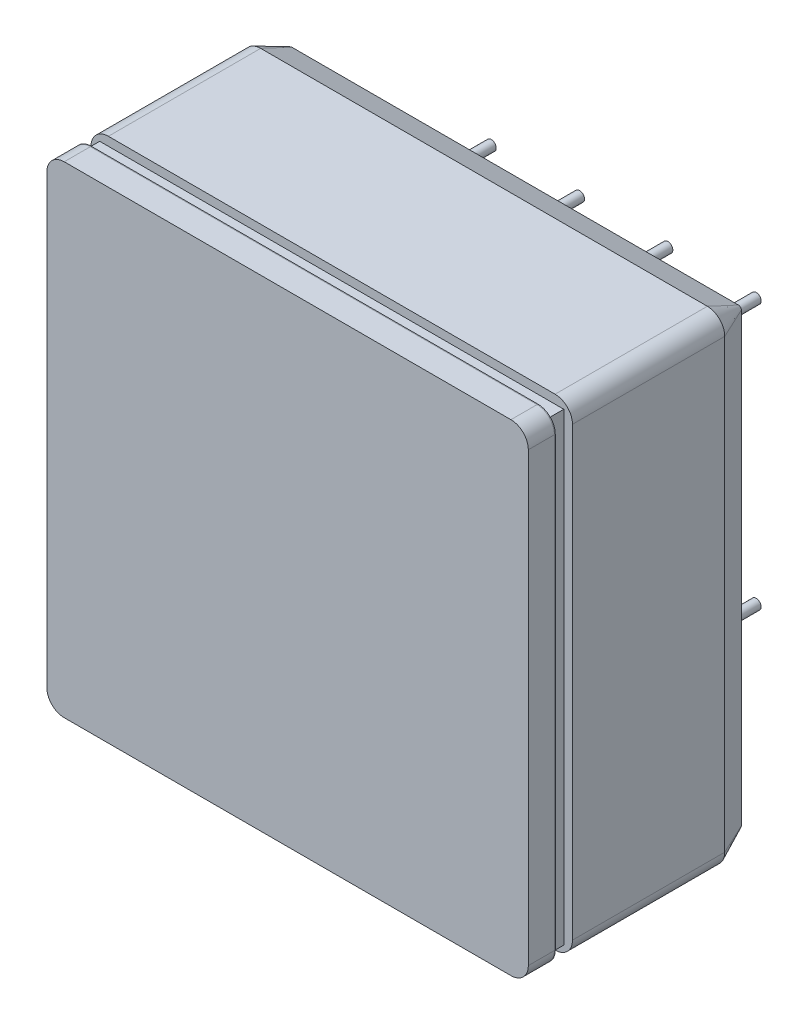
from build123d import *

# Parameters (mm, degrees)
METAL_CASE_AT_HV_DEPTH = 8.76
SKETCH3_W              = 24.737677246
SKETCH3_H              = 24.830501551
PHOTOCATHODE_DEPTH     = 0.1
SKETCH5_W              = 26.7
SKETCH5_H              = 26.7
SKETCH5_W_2            = 23.2
SKETCH5_H_2            = 23.2
BOSS_EXTRUDE3_DEPTH    = 0.99
MIRRORED_SURFACE_START = 0.05
SKETCH6_W              = 23.2
SKETCH6_H              = 23.2
MIRRORED_SURFACE_DEPTH = 0.05
FRONT_GLASS_DEPTH      = 1.5
SKETCH8_R              = 0.285
PINS_DEPTH             = 5.5
SKETCH9_W              = 1.403236588
SKETCH9_H              = 1.496318302
SKETCH9_W_2            = 1.502916358
SKETCH9_H_2            = 1.880163391
SKETCH9_W_3            = 1.432017479
SKETCH9_W_4            = 4.227959696
SKETCH9_W_5            = 1.836353851
SKETCH9_H_3            = 11.695124286
SKETCH9_H_4            = 4.871079897
SKETCH9_W_6            = 1.828629866
SKETCH9_H_5            = 1.71959621
SKETCH9_W_7            = 1.615933227
SKETCH9_W_8            = 1.365330314
SKETCH9_W_9            = 1.525378005
SKETCH9_H_6            = 1.496732956
SKETCH9_W_10           = 17.055037943
SKETCH9_H_7            = 1.444241572
SKETCH9_H_8            = 1.617700465
SKETCH9_H_9            = 1.513765196
SKETCH9_H_10           = 14.892572142
SKETCH9_H_11           = 1.645870576
SKETCH9_H_12           = 1.829290868
SKETCH9_W_11           = 1.140707165
SKETCH9_H_13           = 1.492116291
SKETCH9_W_12           = 1.724036428
SKETCH9_W_13           = 1.316199483
SKETCH9_H_14           = 1.570615298
SKETCH9_W_14           = 1.593474923
SKETCH9_W_15           = 1.889006141
SKETCH9_H_15           = 2.206356806
SKETCH9_W_16           = 6.877190486
SKETCH9_H_16           = 1.783898062
SKETCH9_W_17           = 1.759836844
SKETCH9_H_17           = 1.481039903
CUT_EXTRUDE1_DEPTH     = 5.5
RUBBER_DEPTH           = 1.79
RUBBER_TAPER           = 25


with BuildPart() as part:
    # Sketch2 → metal-case-at-HV (new body)
    with BuildSketch(Plane.XY.offset(-2.54)):
        with BuildLine():
            Line((1, 27.7), (26.7, 27.7))
            ThreePointArc((26.7, 27.7), (27.407106781, 27.407106781), (27.7, 26.7))
            Line((27.7, 26.7), (27.7, 1))
            ThreePointArc((27.7, 1), (27.407106781, 0.292893219), (26.7, 0))
            Line((26.7, 0), (1, 0))
            ThreePointArc((1, 0), (0.292893219, 0.292893219), (0, 1))
            Line((0, 1), (0, 26.7))
            ThreePointArc((0, 26.7), (0.292893219, 27.407106781), (1, 27.7))
        make_face()
    extrude(amount=-METAL_CASE_AT_HV_DEPTH)

    # Sketch3 → photocathode (add)
    with BuildSketch(Plane.XY.offset(-2.54)):
        with Locations((13.757175695, 13.780381772)):
            Rectangle(SKETCH3_W, SKETCH3_H)
    extrude(amount=PHOTOCATHODE_DEPTH)

    # Sketch5 → Boss-Extrude3 (add)
    with BuildSketch(Plane.XY.offset(-2.54)):
        with Locations((13.85, 13.85)):
            Rectangle(SKETCH5_W, SKETCH5_H)
        with Locations((13.85, 13.85)):
            Rectangle(SKETCH5_W_2, SKETCH5_H_2, mode=Mode.SUBTRACT)
    extrude(amount=BOSS_EXTRUDE3_DEPTH)

    # Sketch6 → mirrored-surface (add)
    with BuildSketch(Plane.XY.offset(-1.55).offset(MIRRORED_SURFACE_START)):
        with BuildLine():
            Line((1, 27.7), (26.7, 27.7))
            ThreePointArc((26.7, 27.7), (27.407106781, 27.407106781), (27.7, 26.7))
            Line((27.7, 26.7), (27.7, 1))
            ThreePointArc((27.7, 1), (27.407106781, 0.292893219), (26.7, 0))
            Line((26.7, 0), (1, 0))
            ThreePointArc((1, 0), (0.292893219, 0.292893219), (0, 1))
            Line((0, 1), (0, 26.7))
            ThreePointArc((0, 26.7), (0.292893219, 27.407106781), (1, 27.7))
        make_face()
        with Locations((13.85, 13.85)):
            Rectangle(SKETCH6_W, SKETCH6_H, mode=Mode.SUBTRACT)
    extrude(amount=-MIRRORED_SURFACE_DEPTH)

    # Sketch8 → pins (add)
    with BuildSketch(Plane(origin=(0, 0, -11.3), x_dir=(-1, 0, 0), z_dir=(0, 0, -1))):
        with Locations((-24.01, 3.69)):
            Circle(SKETCH8_R)
        with Locations((-21.47, 3.69)):
            Circle(SKETCH8_R)
        with Locations((-18.93, 3.69)):
            Circle(SKETCH8_R)
        with Locations((-16.39, 3.69)):
            Circle(SKETCH8_R)
        with Locations((-13.85, 3.69)):
            Circle(SKETCH8_R)
        with Locations((-11.31, 3.69)):
            Circle(SKETCH8_R)
        with Locations((-8.77, 3.69)):
            Circle(SKETCH8_R)
        with Locations((-6.23, 3.69)):
            Circle(SKETCH8_R)
        with Locations((-3.69, 3.69)):
            Circle(SKETCH8_R)
        with Locations((-24.01, 6.23)):
            Circle(SKETCH8_R)
        with Locations((-21.47, 6.23)):
            Circle(SKETCH8_R)
        with Locations((-18.93, 6.23)):
            Circle(SKETCH8_R)
        with Locations((-16.39, 6.23)):
            Circle(SKETCH8_R)
        with Locations((-13.85, 6.23)):
            Circle(SKETCH8_R)
        with Locations((-11.31, 6.23)):
            Circle(SKETCH8_R)
        with Locations((-8.77, 6.23)):
            Circle(SKETCH8_R)
        with Locations((-6.23, 6.23)):
            Circle(SKETCH8_R)
        with Locations((-3.69, 6.23)):
            Circle(SKETCH8_R)
        with Locations((-24.01, 8.77)):
            Circle(SKETCH8_R)
        with Locations((-21.47, 8.77)):
            Circle(SKETCH8_R)
        with Locations((-18.93, 8.77)):
            Circle(SKETCH8_R)
        with Locations((-16.39, 8.77)):
            Circle(SKETCH8_R)
        with Locations((-13.85, 8.77)):
            Circle(SKETCH8_R)
        with Locations((-11.31, 8.77)):
            Circle(SKETCH8_R)
        with Locations((-8.77, 8.77)):
            Circle(SKETCH8_R)
        with Locations((-6.23, 8.77)):
            Circle(SKETCH8_R)
        with Locations((-3.69, 8.77)):
            Circle(SKETCH8_R)
        with Locations((-24.01, 11.31)):
            Circle(SKETCH8_R)
        with Locations((-21.47, 11.31)):
            Circle(SKETCH8_R)
        with Locations((-18.93, 11.31)):
            Circle(SKETCH8_R)
        with Locations((-16.39, 11.31)):
            Circle(SKETCH8_R)
        with Locations((-13.85, 11.31)):
            Circle(SKETCH8_R)
        with Locations((-11.31, 11.31)):
            Circle(SKETCH8_R)
        with Locations((-8.77, 11.31)):
            Circle(SKETCH8_R)
        with Locations((-6.23, 11.31)):
            Circle(SKETCH8_R)
        with Locations((-3.69, 11.31)):
            Circle(SKETCH8_R)
        with Locations((-24.01, 13.85)):
            Circle(SKETCH8_R)
        with Locations((-21.47, 13.85)):
            Circle(SKETCH8_R)
        with Locations((-18.93, 13.85)):
            Circle(SKETCH8_R)
        with Locations((-16.39, 13.85)):
            Circle(SKETCH8_R)
        with Locations((-13.85, 13.85)):
            Circle(SKETCH8_R)
        with Locations((-11.31, 13.85)):
            Circle(SKETCH8_R)
        with Locations((-8.77, 13.85)):
            Circle(SKETCH8_R)
        with Locations((-6.23, 13.85)):
            Circle(SKETCH8_R)
        with Locations((-3.69, 13.85)):
            Circle(SKETCH8_R)
        with Locations((-24.01, 16.39)):
            Circle(SKETCH8_R)
        with Locations((-21.47, 16.39)):
            Circle(SKETCH8_R)
        with Locations((-18.93, 16.39)):
            Circle(SKETCH8_R)
        with Locations((-16.39, 16.39)):
            Circle(SKETCH8_R)
        with Locations((-13.85, 16.39)):
            Circle(SKETCH8_R)
        with Locations((-11.31, 16.39)):
            Circle(SKETCH8_R)
        with Locations((-8.77, 16.39)):
            Circle(SKETCH8_R)
        with Locations((-6.23, 16.39)):
            Circle(SKETCH8_R)
        with Locations((-3.69, 16.39)):
            Circle(SKETCH8_R)
        with Locations((-24.01, 18.93)):
            Circle(SKETCH8_R)
        with Locations((-21.47, 18.93)):
            Circle(SKETCH8_R)
        with Locations((-18.93, 18.93)):
            Circle(SKETCH8_R)
        with Locations((-16.39, 18.93)):
            Circle(SKETCH8_R)
        with Locations((-13.85, 18.93)):
            Circle(SKETCH8_R)
        with Locations((-11.31, 18.93)):
            Circle(SKETCH8_R)
        with Locations((-8.77, 18.93)):
            Circle(SKETCH8_R)
        with Locations((-6.23, 18.93)):
            Circle(SKETCH8_R)
        with Locations((-3.69, 18.93)):
            Circle(SKETCH8_R)
        with Locations((-24.01, 21.47)):
            Circle(SKETCH8_R)
        with Locations((-21.47, 21.47)):
            Circle(SKETCH8_R)
        with Locations((-18.93, 21.47)):
            Circle(SKETCH8_R)
        with Locations((-16.39, 21.47)):
            Circle(SKETCH8_R)
        with Locations((-13.85, 21.47)):
            Circle(SKETCH8_R)
        with Locations((-11.31, 21.47)):
            Circle(SKETCH8_R)
        with Locations((-8.77, 21.47)):
            Circle(SKETCH8_R)
        with Locations((-6.23, 21.47)):
            Circle(SKETCH8_R)
        with Locations((-3.69, 21.47)):
            Circle(SKETCH8_R)
        with Locations((-24.01, 24.01)):
            Circle(SKETCH8_R)
        with Locations((-21.47, 24.01)):
            Circle(SKETCH8_R)
        with Locations((-18.93, 24.01)):
            Circle(SKETCH8_R)
        with Locations((-16.39, 24.01)):
            Circle(SKETCH8_R)
        with Locations((-13.85, 24.01)):
            Circle(SKETCH8_R)
        with Locations((-11.31, 24.01)):
            Circle(SKETCH8_R)
        with Locations((-8.77, 24.01)):
            Circle(SKETCH8_R)
        with Locations((-6.23, 24.01)):
            Circle(SKETCH8_R)
        with Locations((-3.69, 24.01)):
            Circle(SKETCH8_R)
    extrude(amount=PINS_DEPTH)

    # Sketch9 → Cut-Extrude1 (cut)
    with BuildSketch(Plane(origin=(0, 0, -16.8), x_dir=(-1, 0, 0), z_dir=(0, 0, -1))):
        with Locations((-21.480019138, 24.113026159)):
            Rectangle(SKETCH9_W, SKETCH9_H)
        with Locations((-16.559216808, 23.921103615)):
            Rectangle(SKETCH9_W_2, SKETCH9_H_2)
        with Locations((-11.149493241, 23.921103615)):
            Rectangle(SKETCH9_W_3, SKETCH9_H_2)
        with Locations((-5.093958278, 24.113026159)):
            Rectangle(SKETCH9_W_4, SKETCH9_H)
        with Locations((-23.96533774, 16.379524364)):
            Rectangle(SKETCH9_W_5, SKETCH9_H_3)
        with Locations((-23.96533774, 5.141508534)):
            Rectangle(SKETCH9_W_5, SKETCH9_H_4)
        with Locations((-18.879223075, 21.590151656)):
            Rectangle(SKETCH9_W_6, SKETCH9_H_5)
        with Locations((-13.758710646, 21.590151656)):
            Rectangle(SKETCH9_W_7, SKETCH9_H_5)
        with Locations((-8.69295177, 21.590151656)):
            Rectangle(SKETCH9_W_8, SKETCH9_H_5)
        with Locations((-3.742667433, 21.478720029)):
            Rectangle(SKETCH9_W_9, SKETCH9_H_6)
        with Locations((-13.896295437, 19.092329501)):
            Rectangle(SKETCH9_W_10, SKETCH9_H_7)
        with Locations((-13.896295437, 13.951861682)):
            Rectangle(SKETCH9_W_10, SKETCH9_H_8)
        with Locations((-13.896295437, 8.881967989)):
            Rectangle(SKETCH9_W_10, SKETCH9_H_9)
        with Locations((-3.742667433, 10.152254656)):
            Rectangle(SKETCH9_W_9, SKETCH9_H_10)
        with Locations((-18.879223075, 16.504452811)):
            Rectangle(SKETCH9_W_6, SKETCH9_H_11)
        with Locations((-13.758710646, 16.504452811)):
            Rectangle(SKETCH9_W_7, SKETCH9_H_11)
        with Locations((-8.69295177, 16.504452811)):
            Rectangle(SKETCH9_W_8, SKETCH9_H_11)
        with Locations((-8.69295177, 11.446607655)):
            Rectangle(SKETCH9_W_8, SKETCH9_H_12)
        with Locations((-8.805263345, 6.274958053)):
            Rectangle(SKETCH9_W_11, SKETCH9_H_13)
        with Locations((-14.11249599, 6.274958053)):
            Rectangle(SKETCH9_W_12, SKETCH9_H_13)
        with Locations((-13.908577517, 11.31726987)):
            Rectangle(SKETCH9_W_13, SKETCH9_H_14)
        with Locations((-18.996800547, 11.446607655)):
            Rectangle(SKETCH9_W_14, SKETCH9_H_12)
        with Locations((-18.879223075, 6.274958053)):
            Rectangle(SKETCH9_W_6, SKETCH9_H_13)
        with Locations((-21.479311338, 3.809146988)):
            Rectangle(SKETCH9_W_15, SKETCH9_H_15)
        with Locations((-13.872079744, 3.597917616)):
            Rectangle(SKETCH9_W_16, SKETCH9_H_16)
        with Locations((-6.657233785, 3.749346696)):
            Rectangle(SKETCH9_W_17, SKETCH9_H_17)
    extrude(amount=-CUT_EXTRUDE1_DEPTH, mode=Mode.SUBTRACT)


with BuildPart() as body_2:
    # Sketch7 → front-glass (new body)
    with BuildSketch(Plane.XY.offset(-1.5)):
        with BuildLine():
            Line((1, 27.7), (26.7, 27.7))
            ThreePointArc((26.7, 27.7), (27.407106781, 27.407106781), (27.7, 26.7))
            Line((27.7, 26.7), (27.7, 1))
            ThreePointArc((27.7, 1), (27.407106781, 0.292893219), (26.7, 0))
            Line((26.7, 0), (1, 0))
            ThreePointArc((1, 0), (0.292893219, 0.292893219), (0, 1))
            Line((0, 1), (0, 26.7))
            ThreePointArc((0, 26.7), (0.292893219, 27.407106781), (1, 27.7))
        make_face()
    extrude(amount=FRONT_GLASS_DEPTH)


with BuildPart() as body_3:
    # Sketch10 → rubber (new body)
    with BuildSketch(Plane(origin=(0, 0, -11.3), x_dir=(-1, 0, 0), z_dir=(0, 0, -1))):
        with BuildLine():
            ThreePointArc((-26.7, 27.7), (-27.407106781, 27.407106781), (-27.7, 26.7))
            Line((-27.7, 26.7), (-27.7, 1))
            ThreePointArc((-27.7, 1), (-27.407106781, 0.292893219), (-26.7, 0))
            Line((-26.7, 0), (-1, 0))
            ThreePointArc((-1, 0), (-0.292893219, 0.292893219), (0, 1))
            Line((0, 1), (0, 26.7))
            ThreePointArc((0, 26.7), (-0.292893219, 27.407106781), (-1, 27.7))
            Line((-1, 27.7), (-26.7, 27.7))
        make_face()
    extrude(amount=RUBBER_DEPTH, taper=RUBBER_TAPER)


solid = Compound([part.part, body_2.part, body_3.part])
